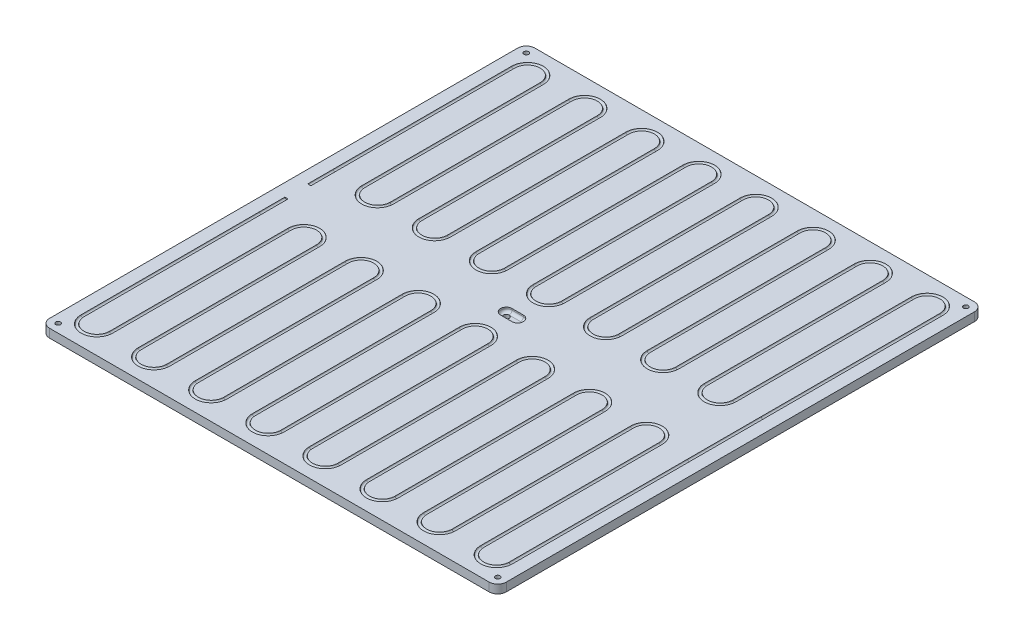
from build123d import *

# Parameters (mm, degrees)
EXTRUDE_1_DEPTH     = 6
CUT_EXTRUDE_1_DEPTH = 3
FILLET_4_R          = 2
SKETCH_3_R          = 1.1
SKETCH_5_R          = 1.65
SKETCH_5_R_2        = 2
CUT_EXTRUDE_2_DEPTH = 244.909819401


with BuildPart() as part:
    # Эскиз1 → Бобышка-Вытянуть1 (new body)
    with BuildSketch(Plane(origin=(0, 0, 0), x_dir=(1, 0, 0), z_dir=(0, 1, 0))):
        with BuildLine():
            Line((-154, -156), (154, -156))
            ThreePointArc((154, -156), (158.242640687, -154.242640687), (160, -150))
            Line((160, -150), (160, 178))
            ThreePointArc((160, 178), (158.242640687, 182.242640687), (154, 184))
            Line((154, 184), (-154, 184))
            ThreePointArc((-154, 184), (-158.242640687, 182.242640687), (-160, 178))
            Line((-160, 178), (-160, -150))
            ThreePointArc((-160, -150), (-158.242640687, -154.242640687), (-154, -156))
        make_face()
    extrude(amount=EXTRUDE_1_DEPTH)

    # Эскиз4 → Вырез-Вытянуть1 (cut)
    with BuildSketch(Plane(origin=(0, 6, 0), x_dir=(1, 0, 0), z_dir=(0, 1, 0))):
        with BuildLine():
            Line((-4, 18), (4, 18))
            ThreePointArc((4, 18), (8, 14), (4, 10))
            Line((4, 10), (-4, 10))
            ThreePointArc((-4, 10), (-8, 14), (-4, 18))
        make_face()
    extrude(amount=-CUT_EXTRUDE_1_DEPTH, mode=Mode.SUBTRACT)

    # Скругление4
    fillet_4_edges = [part.edges().sort_by_distance(p)[0] for p in [
        (0, 3, -18),
        (8, 3, -14),
        (0, 3, -10),
        (-8, 3, -14),
    ]]
    fillet(fillet_4_edges, radius=FILLET_4_R)

    # Вырез-По траектории1: sweep along a path in Эскиз2
    with BuildLine(Plane(origin=(0, 6, 0), x_dir=(1, 0, 0), z_dir=(0, 1, 0))) as sweep_1_path:
        Line((-150, 22), (-150, 39.823529412))
        Line((-150, 39.823529412), (-150, 164.823529412))
        ThreePointArc((-150, 164.823529412), (-140, 174.823529412), (-130, 164.823529412))
        Line((-130, 164.823529412), (-130, 39.823529412))
        ThreePointArc((-130, 39.823529412), (-120, 29.823529412), (-110, 39.823529412))
        Line((-110, 39.823529412), (-110, 164.823529412))
        ThreePointArc((-110, 164.823529412), (-100, 174.823529412), (-90, 164.823529412))
        Line((-90, 164.823529412), (-90, 39.823529412))
        ThreePointArc((-90, 39.823529412), (-80, 29.823529412), (-70, 39.823529412))
        Line((-70, 39.823529412), (-70, 164.823529412))
        ThreePointArc((-70, 164.823529412), (-60, 174.823529412), (-50, 164.823529412))
        Line((-50, 164.823529412), (-50, 39.823529412))
        ThreePointArc((-50, 39.823529412), (-40, 29.823529412), (-30, 39.823529412))
        Line((-30, 39.823529412), (-30, 164.823529412))
        ThreePointArc((-30, 164.823529412), (-20, 174.823529412), (-10, 164.823529412))
        Line((-10, 164.823529412), (-10, 39.823529412))
        ThreePointArc((-10, 39.823529412), (0, 29.823529412), (10, 39.823529412))
        Line((10, 39.823529412), (10, 164.823529412))
        ThreePointArc((10, 164.823529412), (20, 174.823529412), (30, 164.823529412))
        Line((30, 164.823529412), (30, 39.823529412))
        ThreePointArc((30, 39.823529412), (40, 29.823529412), (50, 39.823529412))
        Line((50, 39.823529412), (50, 164.823529412))
        ThreePointArc((50, 164.823529412), (60, 174.823529412), (70, 164.823529412))
        Line((70, 164.823529412), (70, 39.823529412))
        ThreePointArc((70, 39.823529412), (80, 29.823529412), (90, 39.823529412))
        Line((90, 39.823529412), (90, 164.823529412))
        ThreePointArc((90, 164.823529412), (100, 174.823529412), (110, 164.823529412))
        Line((110, 164.823529412), (110, 39.823529412))
        ThreePointArc((110, 39.823529412), (120, 29.823529412), (130, 39.823529412))
        Line((130, 39.823529412), (130, 164.823529412))
        ThreePointArc((130, 164.823529412), (140, 174.823529412), (150, 164.823529412))
        Line((150, 164.823529412), (150, 39.823529412))
        Line((150, 39.823529412), (150, -11.823529412))
        Line((150, -11.823529412), (150, -136.823529412))
        ThreePointArc((150, -136.823529412), (140, -146.823529412), (130, -136.823529412))
        Line((130, -136.823529412), (130, -11.823529412))
        ThreePointArc((130, -11.823529412), (120, -1.823529412), (110, -11.823529412))
        Line((110, -11.823529412), (110, -136.823529412))
        ThreePointArc((110, -136.823529412), (100, -146.823529412), (90, -136.823529412))
        Line((90, -136.823529412), (90, -11.823529412))
        ThreePointArc((90, -11.823529412), (80, -1.823529412), (70, -11.823529412))
        Line((70, -11.823529412), (70, -136.823529412))
        ThreePointArc((70, -136.823529412), (60, -146.823529412), (50, -136.823529412))
        Line((50, -136.823529412), (50, -11.823529412))
        ThreePointArc((50, -11.823529412), (40, -1.823529412), (30, -11.823529412))
        Line((30, -11.823529412), (30, -136.823529412))
        ThreePointArc((30, -136.823529412), (20, -146.823529412), (10, -136.823529412))
        Line((10, -136.823529412), (10, -11.823529412))
        ThreePointArc((10, -11.823529412), (0, -1.823529412), (-10, -11.823529412))
        Line((-10, -11.823529412), (-10, -136.823529412))
        ThreePointArc((-10, -136.823529412), (-20, -146.823529412), (-30, -136.823529412))
        Line((-30, -136.823529412), (-30, -11.823529412))
        ThreePointArc((-30, -11.823529412), (-40, -1.823529412), (-50, -11.823529412))
        Line((-50, -11.823529412), (-50, -136.823529412))
        ThreePointArc((-50, -136.823529412), (-60, -146.823529412), (-70, -136.823529412))
        Line((-70, -136.823529412), (-70, -11.823529412))
        ThreePointArc((-70, -11.823529412), (-80, -1.823529412), (-90, -11.823529412))
        Line((-90, -11.823529412), (-90, -136.823529412))
        ThreePointArc((-90, -136.823529412), (-100, -146.823529412), (-110, -136.823529412))
        Line((-110, -136.823529412), (-110, -11.823529412))
        ThreePointArc((-110, -11.823529412), (-120, -1.823529412), (-130, -11.823529412))
        Line((-130, -11.823529412), (-130, -136.823529412))
        ThreePointArc((-130, -136.823529412), (-140, -146.823529412), (-150, -136.823529412))
        Line((-150, -136.823529412), (-150, -11.823529412))
        Line((-150, -11.823529412), (-150, 6))
    # Эскиз3 → Вырез-По траектории1 (sweep, cut)
    with BuildSketch(Plane.XY.offset(-22)):
        with Locations((-150, 6)):
            Circle(SKETCH_3_R)
    sweep(path=sweep_1_path.line, mode=Mode.SUBTRACT)

    # Эскиз5 → Вырез-Вытянуть2 (cut, through all)
    with BuildSketch(Plane(origin=(0, 6, 0), x_dir=(1, 0, 0), z_dir=(0, 1, 0))):
        with Locations((-154, 178)):
            Circle(SKETCH_5_R)
        with Locations((154, 178)):
            Circle(SKETCH_5_R)
        with Locations((154, -150)):
            Circle(SKETCH_5_R)
        with Locations((-154, -150)):
            Circle(SKETCH_5_R)
        with Locations((-4, 14)):
            Circle(SKETCH_5_R_2)
    extrude(amount=-CUT_EXTRUDE_2_DEPTH, mode=Mode.SUBTRACT)


solid = part.part
